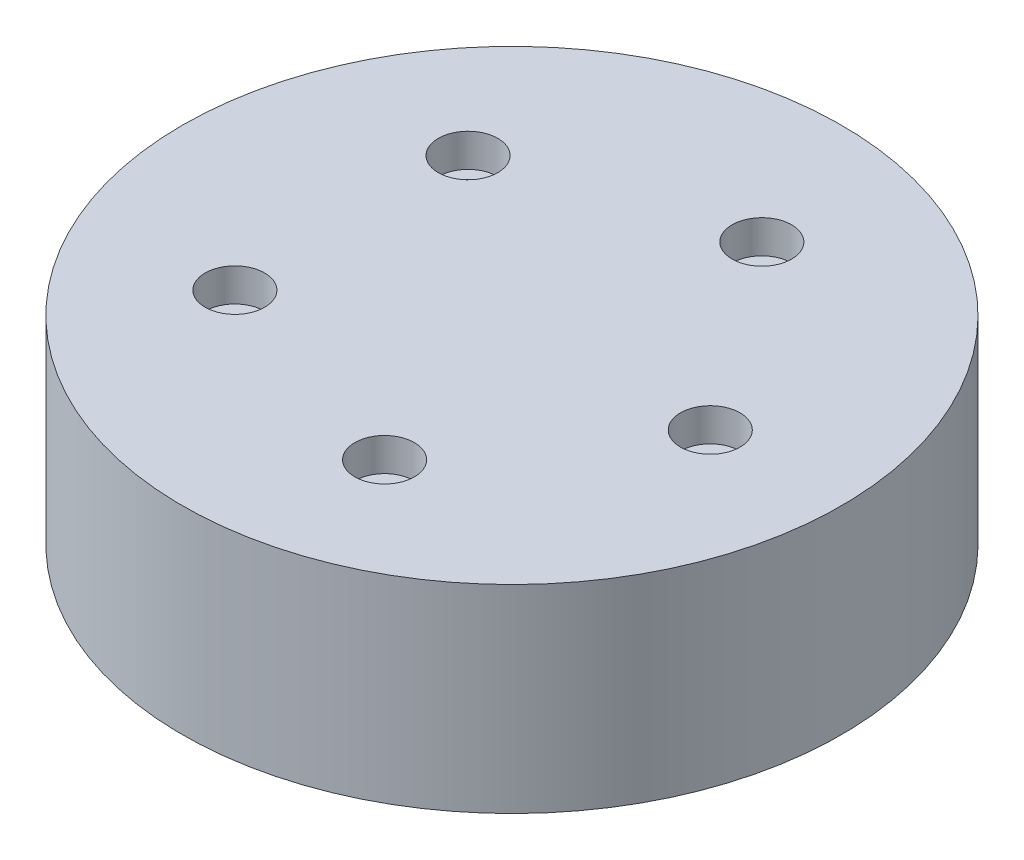
from build123d import *

# Parameters (mm, degrees)
BOSS_EXTRUDE1_DEPTH              = 5
BOSS_EXTRUDE1_DEPTH_BACK         = 10
SKETCH3_R                        = 24.925
SKETCH3_R_2                      = 1.3
SKETCH6_R                        = 1.65
CUT_EXTRUDE1_DEPTH               = 5
CBORE_FOR_M2_5_SHCS1_D           = 2.5
CBORE_FOR_M2_5_SHCS1_CBORE_D     = 4.5
CBORE_FOR_M2_5_SHCS1_CBORE_DEPTH = 2.5


with BuildPart() as part:
    # Sketch3 → Boss-Extrude1 (new, two sides: drawn at the far end of the back side and taken through both)
    with BuildSketch(Plane(origin=(0, 15, 0), x_dir=(1, 0, 0), z_dir=(0, 1, 0)).offset(-BOSS_EXTRUDE1_DEPTH_BACK)):
        with Locations((-1.2, 0)):
            Circle(SKETCH3_R)
        with Locations((13.8, 0)):
            Circle(SKETCH3_R_2, mode=Mode.SUBTRACT)
        with Locations((3.435254916, 14.265847744)):
            Circle(SKETCH3_R_2, mode=Mode.SUBTRACT)
        with Locations((-13.335254916, 8.816778784)):
            Circle(SKETCH3_R_2, mode=Mode.SUBTRACT)
        with Locations((-13.335254916, -8.816778784)):
            Circle(SKETCH3_R_2, mode=Mode.SUBTRACT)
        with Locations((3.435254916, -14.265847744)):
            Circle(SKETCH3_R_2, mode=Mode.SUBTRACT)
    extrude(amount=BOSS_EXTRUDE1_DEPTH + BOSS_EXTRUDE1_DEPTH_BACK)

    # Sketch6 → Cut-Extrude1 (cut)
    with BuildSketch(Plane.XZ.offset(-5)):
        with Locations((13.8, 0)):
            Circle(SKETCH6_R)
        with Locations((3.435254916, -14.265847744)):
            Circle(SKETCH6_R)
        with Locations((-13.335254915, -8.816778784)):
            Circle(SKETCH6_R)
        with Locations((-13.335254915, 8.816778784)):
            Circle(SKETCH6_R)
        with Locations((3.435254916, 14.265847744)):
            Circle(SKETCH6_R)
    extrude(amount=-CUT_EXTRUDE1_DEPTH, mode=Mode.SUBTRACT)

    # CBORE for M2.5 SHCS1 (through all)
    with Locations(Plane(origin=(0, 20, 0), x_dir=(1, 0, 0), z_dir=(0, 1, 0))):
        with Locations((13.8, 0), (3.435254916, -14.265847744), (-13.335254916, -8.816778784), (3.435254916, 14.265847744), (-13.335254916, 8.816778784)):
            CounterBoreHole(CBORE_FOR_M2_5_SHCS1_D / 2, CBORE_FOR_M2_5_SHCS1_CBORE_D / 2, CBORE_FOR_M2_5_SHCS1_CBORE_DEPTH)


solid = part.part
